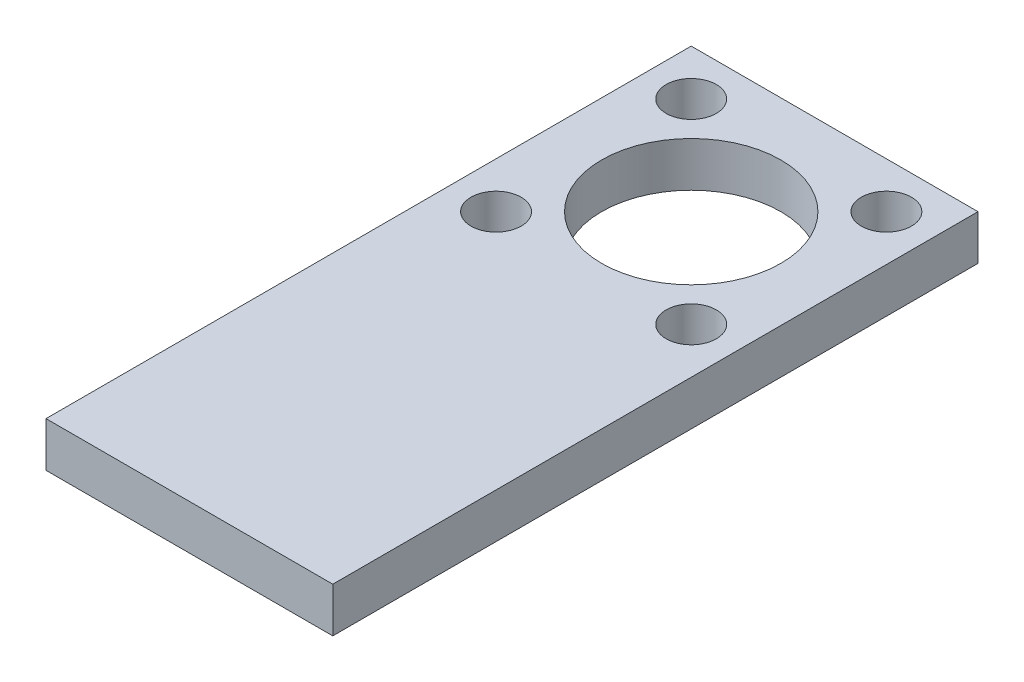
from build123d import *

# Parameters (mm, degrees)
SKETCH2_W           = 20.32
SKETCH2_H           = 45.72
BOSS_EXTRUDE4_DEPTH = 3.175
SKETCH7_R           = 1.778
SKETCH7_R_2         = 6.35
CUT_EXTRUDE1_DEPTH  = 3.175


with BuildPart() as part:
    # Sketch2 → Boss-Extrude4 (new body)
    with BuildSketch(Plane(origin=(0, 0, 0), x_dir=(1, 0, 0), z_dir=(0, 1, 0))):
        with Locations((-10.16, -22.86)):
            Rectangle(SKETCH2_W, SKETCH2_H)
    extrude(amount=BOSS_EXTRUDE4_DEPTH)

    # Sketch7 → Cut-Extrude1 (cut)
    with BuildSketch(Plane(origin=(0, 3.175, 0), x_dir=(1, 0, 0), z_dir=(0, 1, 0))):
        with Locations((-17.074797213, -17.074797213)):
            Circle(SKETCH7_R)
        with Locations((-3.245202787, -17.074797213)):
            Circle(SKETCH7_R)
        with Locations((-17.074797213, -3.245202787)):
            Circle(SKETCH7_R)
        with Locations((-3.245202787, -3.245202787)):
            Circle(SKETCH7_R)
        with Locations((-10.16, -10.16)):
            Circle(SKETCH7_R_2)
    extrude(amount=-CUT_EXTRUDE1_DEPTH, mode=Mode.SUBTRACT)


solid = part.part
